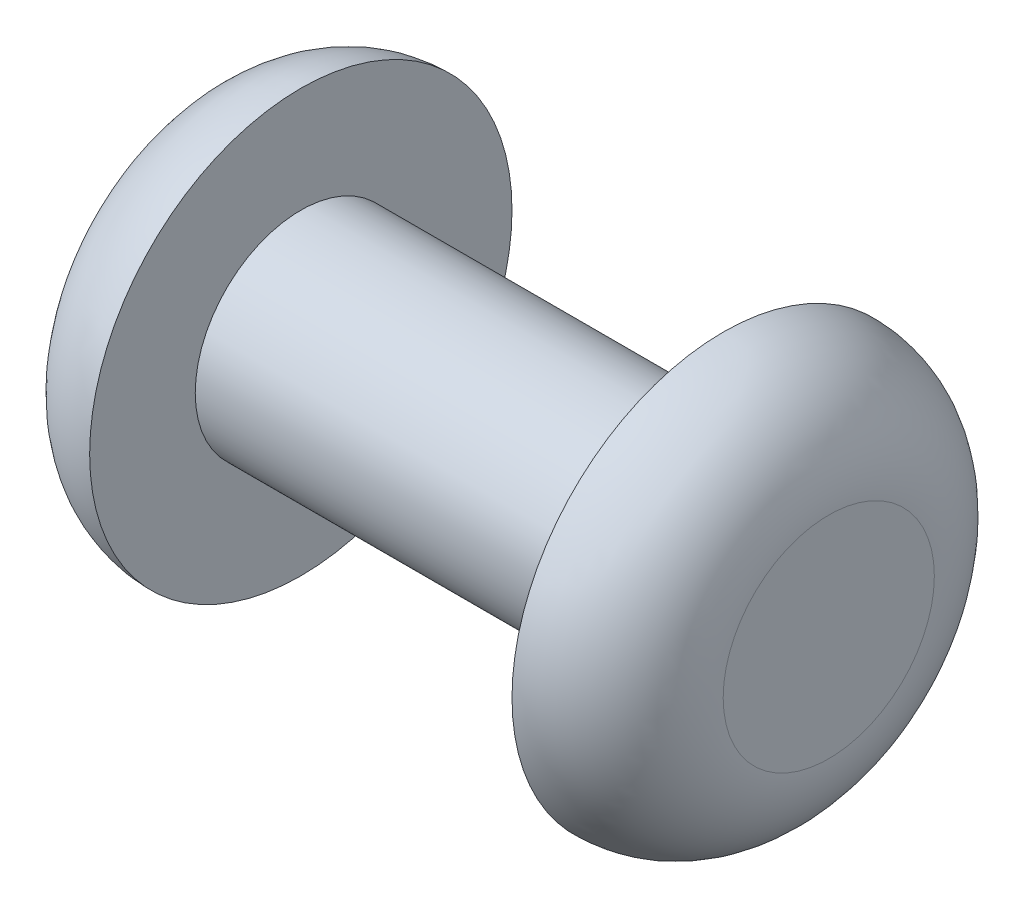
from build123d import *

# Parameters (mm, degrees)
SKETCH1_R            = 10
BOSS_EXTRUDE1_DEPTH  = 40
SKETCH2_R            = 20
BOSS_EXTRUDE2_DEPTH  = 10
FILLET1_R            = 10
FILLET1_OF_MIRROR1_R = 10


with BuildPart() as part:
    # Sketch1 → Boss-Extrude1 (new body)
    with BuildSketch(Plane(origin=(0, 0, 0), x_dir=(0, 0, -1), z_dir=(1, 0, 0))):
        Circle(SKETCH1_R)
    extrude(amount=BOSS_EXTRUDE1_DEPTH)

    # Sketch2 → Boss-Extrude2 (add)
    with BuildSketch(Plane(origin=(40, 0, 0), x_dir=(0, 0, -1), z_dir=(1, 0, 0))):
        Circle(SKETCH2_R)
    boss_extrude2 = extrude(amount=BOSS_EXTRUDE2_DEPTH)

    # Fillet1
    fillet1_edges = [part.edges().sort_by_distance(p)[0] for p in [
        (50, 0, 20),
    ]]
    fillet(fillet1_edges, radius=FILLET1_R - 0.0001)  # a hair under: the kernel refuses the full size

    # Mirror1: Boss-Extrude2 across plane
    add(boss_extrude2.mirror(Plane.ZY.offset(-20)))

    # Fillet1 of Mirror1
    fillet1_of_mirror1_edges = [part.edges().sort_by_distance(p)[0] for p in [
        (-10, 0, 20),
    ]]
    fillet(fillet1_of_mirror1_edges, radius=FILLET1_OF_MIRROR1_R - 0.0001)  # a hair under: the kernel refuses the full size


solid = part.part
